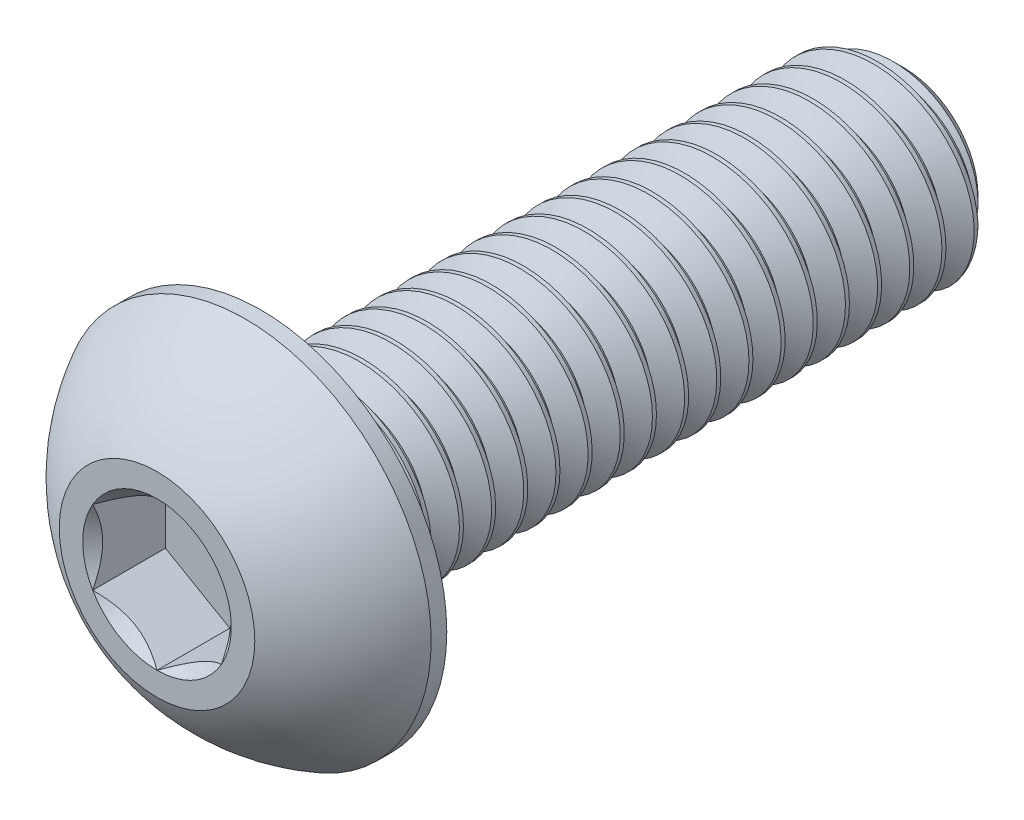
from build123d import *

# Parameters (mm, degrees)
SKETCH1_W          = 15.875
SKETCH1_H          = 2.413
CHAMFER1_SIZE      = 0.5953125
CUT_SWEEP1_PITCH   = 0.79375
CUT_EXTRUDE2_DEPTH = 1.79578
SKETCH6_R          = 1.833087105
CUT_EXTRUDE3_DEPTH = 1.79578
CUT_EXTRUDE3_TAPER = 45


with BuildPart() as part:
    # Sketch1 → Revolve1 (revolve)
    with BuildSketch(Plane(origin=(0, 0, 0), x_dir=(0, 0, -1), z_dir=(1, 0, 0))):
        with Locations((10.5029, 1.2065)):
            Rectangle(SKETCH1_W, SKETCH1_H)
    revolve(axis=Axis((0, 0, -18.4404), (0, 0, 1)))

    # Chamfer1
    chamfer1_edges = [part.edges().sort_by_distance(p)[0] for p in [
        (0, -2.413, -18.4404),
    ]]
    chamfer(chamfer1_edges, length=CHAMFER1_SIZE)

    # Cut-Sweep1: the profile of Sketch2 profile screwed along a right-hand helix of 21 turns, 8 arcs to a turn; built about Z, then put on its axis
    cut_sweep1_z = Axis((0, 0, 0), (0, 0, 1))
    cut_sweep1_corners = [(2.4133, 0, 0.000173205), (2.4133, 0, -0.694704455), (1.897444252, 0, -0.396875), (1.897444252, 0, -0.29765625)]
    with BuildLine(mode=Mode.PRIVATE) as cut_sweep1_profile:
        Line(cut_sweep1_corners[0], cut_sweep1_corners[1])
        Line(cut_sweep1_corners[1], cut_sweep1_corners[2])
        Line(cut_sweep1_corners[2], cut_sweep1_corners[3])
        Line(cut_sweep1_corners[3], cut_sweep1_corners[0])
    cut_sweep1_cap = Face(cut_sweep1_profile.wire())
    cut_sweep1_turn_angles = [0, 22.5, 45, 67.5, 90, 112.5, 135, 157.5, 180, 202.5, 225, 247.5, 270, 292.5, 315, 337.5, 360]
    cut_sweep1_turn_weights = [1, 0.9238795325112867, 1, 0.9238795325112867, 1, 0.9238795325112867, 1, 0.9238795325112867, 1, 0.9238795325112867, 1, 0.9238795325112867, 1, 0.9238795325112867, 1, 0.9238795325112867, 1]
    cut_sweep1_turn_rails = [Edge.make_bspline([Vector(p[0], p[1], 0).rotate(cut_sweep1_z, cut_sweep1_turn_angles[k]) / cut_sweep1_turn_weights[k] + Vector(0, 0, p[2] + CUT_SWEEP1_PITCH * cut_sweep1_turn_angles[k] / 360) for k in range(17)], [0, 0, 0, 1, 1, 2, 2, 3, 3, 4, 4, 5, 5, 6, 6, 7, 7, 8, 8, 8], 2, cut_sweep1_turn_weights) for p in cut_sweep1_corners]
    cut_sweep1_turn_sides = [Face.make_surface_from_curves(cut_sweep1_turn_rails[p[0]], cut_sweep1_turn_rails[p[1]]) for p in [(0, 1), (1, 2), (2, 3), (3, 0)]]
    cut_sweep1 = Plane(origin=(0, 0, -18.4404), x_dir=(0, 1, 0), z_dir=(0, 0, 1)) * Solid(Shell([*[p.moved(Location((0, 0, CUT_SWEEP1_PITCH * i))) for i in range(21) for p in cut_sweep1_turn_sides], cut_sweep1_cap, cut_sweep1_cap.rotate(cut_sweep1_z, 7560).moved(Location((0, 0, CUT_SWEEP1_PITCH * 7560 / 360)))]))
    add(cut_sweep1, mode=Mode.SUBTRACT)

    # Sketch7 → Revolve2 (revolve)
    with BuildSketch(Plane(origin=(0, 0, 0), x_dir=(0, 0, -1), z_dir=(1, 0, 0)), mode=Mode.PRIVATE) as revolve2_sk:
        with BuildLine():
            Line((2.18059, 4.5847), (2.5654, 4.5847))
            Line((2.5654, 4.5847), (2.5654, 0))
            Line((2.5654, 0), (0, 0))
            Line((0, 0), (0, 2.413))
            ThreePointArc((0, 2.413), (0.925030326, 3.664791196), (2.18059, 4.5847))
        make_face()
    revolve(revolve2_sk.sketch.rotate(Axis((0, 0, 0), (0, 0, -1)), 189.052465709), axis=Axis((0, 0, 0), (0, 0, -1)))

    # Sketch5 → Cut-Extrude2 (cut)
    with BuildSketch(Plane.XY):
        Polygon((1.5875, -0.916543552), (1.5875, 0.916543552), (0, 1.833087105), (-1.5875, 0.916543552), (-1.5875, -0.916543552), (0, -1.833087105), align=None)
    extrude(amount=-CUT_EXTRUDE2_DEPTH, mode=Mode.SUBTRACT)

    # Sketch6 → Cut-Extrude3 (cut)
    with BuildSketch(Plane.XY):
        Circle(SKETCH6_R)
    extrude(amount=-CUT_EXTRUDE3_DEPTH, taper=CUT_EXTRUDE3_TAPER, mode=Mode.SUBTRACT)


solid = part.part
